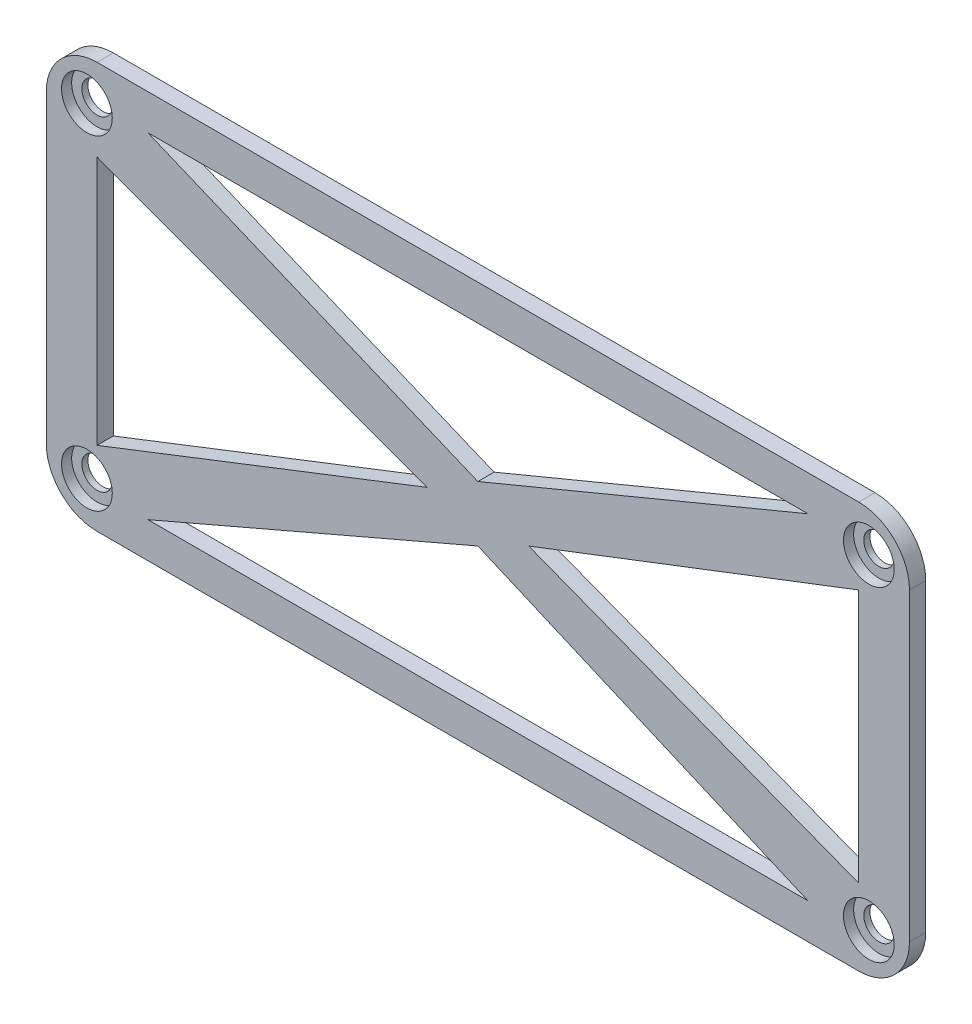
from build123d import *

# Parameters (mm, degrees)
EXTRUDE_1_DEPTH          = 3.2
CUT_EXTRUDE_1_DEPTH      = 39
CUT_EXTRUDE_1_DEPTH_BACK = 10
SKETCH_2_R               = 3
SKETCH_3_R               = 5
CUT_EXTRUDE_2_DEPTH      = 2


with BuildPart() as part:
    # 草图1 → 凸台-拉伸1 (new body)
    with BuildSketch(Plane.XY):
        with BuildLine():
            Line((-72.574116531, 35.487390308), (77.425883469, 35.487390308))
            ThreePointArc((77.425883469, 35.487390308), (84.496951281, 32.558458119), (87.425883469, 25.487390308))
            Line((87.425883469, 25.487390308), (87.425883469, -34.512609692))
            ThreePointArc((87.425883469, -34.512609692), (84.496951281, -41.583677504), (77.425883469, -44.512609692))
            Line((77.425883469, -44.512609692), (-72.574116531, -44.512609692))
            ThreePointArc((-72.574116531, -44.512609692), (-79.645184343, -41.583677504), (-82.574116531, -34.512609692))
            Line((-82.574116531, -34.512609692), (-82.574116531, 25.487390308))
            ThreePointArc((-82.574116531, 25.487390308), (-79.645184343, 32.558458119), (-72.574116531, 35.487390308))
        make_face()
    extrude(amount=EXTRUDE_1_DEPTH)

    # 草图2 → 切除-拉伸1 (cut, two sides: drawn at the far end of the back side and taken through both)
    with BuildSketch(Plane.XY.offset(3.2).offset(-CUT_EXTRUDE_1_DEPTH_BACK)):
        with Locations((-74.574116531, 27.487390308)):
            Circle(SKETCH_2_R)
        with Locations((-74.574116531, -36.512609692)):
            Circle(SKETCH_2_R)
        with Locations((79.425883469, 27.487390308)):
            Circle(SKETCH_2_R)
        with Locations((79.425883469, -36.512609692)):
            Circle(SKETCH_2_R)
        Polygon((-62.574116531, 28.487390308), (2.425883469, 1.487390308), (67.425883469, 28.487390308), align=None)
        Polygon((-72.574116531, 19.326272769), (-7.574116531, -4.512609692), (-72.574116531, -29.843914394), align=None)
        Polygon((2.425883469, -9.512609692), (-62.574116531, -37.512609692), (67.425883469, -37.512609692), align=None)
        Polygon((12.425883469, -4.512609692), (77.425883469, 20.487390308), (77.425883469, -29.512609692), align=None)
    extrude(amount=CUT_EXTRUDE_1_DEPTH + CUT_EXTRUDE_1_DEPTH_BACK, mode=Mode.SUBTRACT)

    # 草图3 → 切除-拉伸2 (cut)
    with BuildSketch(Plane.XY.offset(3.2)):
        with Locations((-74.574116531, 27.487390308)):
            Circle(SKETCH_3_R)
        with Locations((79.425883469, 27.487390308)):
            Circle(SKETCH_3_R)
        with Locations((79.425883469, -36.512609692)):
            Circle(SKETCH_3_R)
        with Locations((-74.574116531, -36.512609692)):
            Circle(SKETCH_3_R)
    extrude(amount=-CUT_EXTRUDE_2_DEPTH, mode=Mode.SUBTRACT)


solid = part.part
